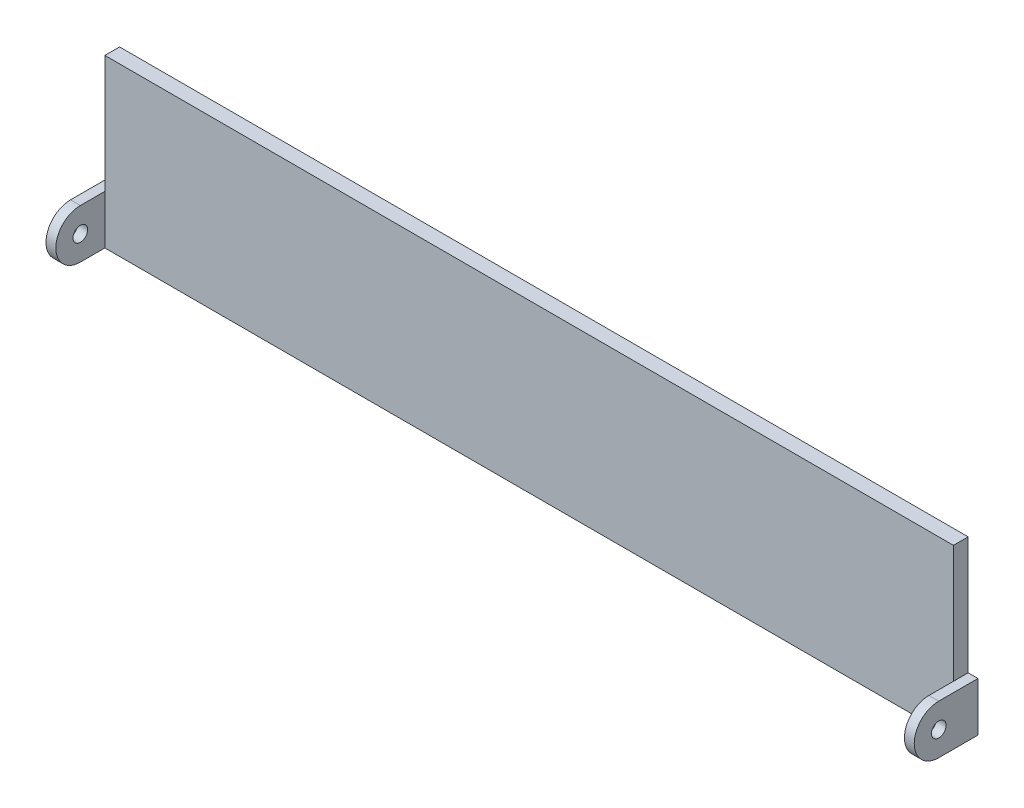
from build123d import *

# Parameters (mm, degrees)
SKETCH1_W           = 173
SKETCH1_H           = 34
BOSS_EXTRUDE1_DEPTH = 3
SKETCH2_R           = 5
SKETCH2_W           = 8
SKETCH2_H           = 10
BOSS_EXTRUDE2_DEPTH = 2
BOSS_EXTRUDE3_START = 2
SKETCH3_R           = 5
SKETCH3_W           = 8
SKETCH3_H           = 10
BOSS_EXTRUDE3_DEPTH = 2
SKETCH4_R           = 1.5
CUT_EXTRUDE1_DEPTH  = 200


with BuildPart() as part:
    # Sketch1 → Boss-Extrude1 (new body)
    with BuildSketch(Plane.XY):
        with Locations((0, -4.5)):
            Rectangle(SKETCH1_W, SKETCH1_H)
    extrude(amount=BOSS_EXTRUDE1_DEPTH)

    # Sketch2 → Boss-Extrude2 (add)
    with BuildSketch(Plane.ZY.offset(86.5)):
        with Locations((8, -16.5)):
            Circle(SKETCH2_R)
        with Locations((4, -16.5)):
            Rectangle(SKETCH2_W, SKETCH2_H)
    extrude(amount=BOSS_EXTRUDE2_DEPTH)

    # Sketch3 → Boss-Extrude3 (add)
    with BuildSketch(Plane(origin=(86.5, 0, 0), x_dir=(0, 0, -1), z_dir=(1, 0, 0)).offset(BOSS_EXTRUDE3_START)):
        with Locations((-8, -16.5)):
            Circle(SKETCH3_R)
        with Locations((-4, -16.5)):
            Rectangle(SKETCH3_W, SKETCH3_H)
    extrude(amount=-BOSS_EXTRUDE3_DEPTH)

    # Sketch4 → Cut-Extrude1 (cut)
    with BuildSketch(Plane(origin=(88.5, 0, 0), x_dir=(0, 0, -1), z_dir=(1, 0, 0))):
        with Locations((-8, -16.5)):
            Circle(SKETCH4_R)
    extrude(amount=-CUT_EXTRUDE1_DEPTH, mode=Mode.SUBTRACT)


solid = part.part
